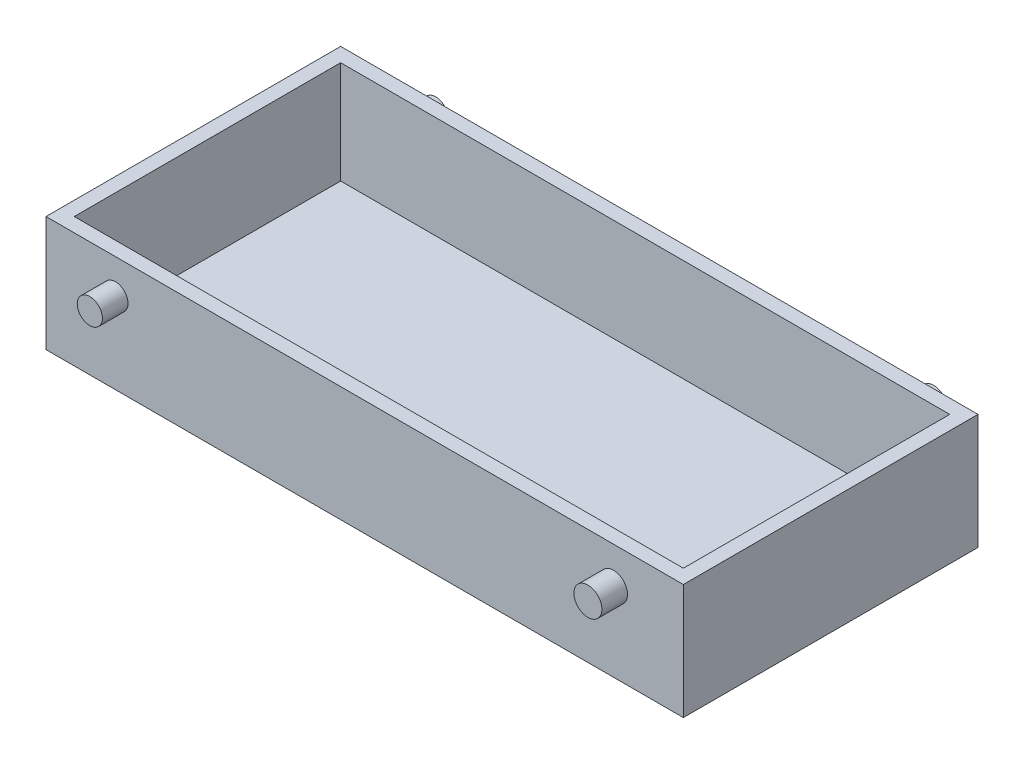
from build123d import *

# Parameters (mm, degrees)
SKETCH1_W           = 315.98108
SKETCH1_H           = 146.08048
SKETCH1_W_2         = 301.9806
SKETCH1_H_2         = 132.08
BOSS_EXTRUDE1_DEPTH = 50.8
SKETCH3_W           = 315.98108
SKETCH3_H           = 146.08048
BOSS_EXTRUDE2_DEPTH = 6.35
SKETCH4_R           = 6.24245598
SKETCH4_R_2         = 6.948260199
BOSS_EXTRUDE3_DEPTH = 12.7


with BuildPart() as part:
    # Sketch1 → Boss-Extrude1 (new body)
    with BuildSketch(Plane(origin=(0, 0, 0), x_dir=(1, 0, 0), z_dir=(0, 1, 0))):
        Rectangle(SKETCH1_W, SKETCH1_H)
        Rectangle(SKETCH1_W_2, SKETCH1_H_2, mode=Mode.SUBTRACT)
    extrude(amount=BOSS_EXTRUDE1_DEPTH)

    # Sketch3 → Boss-Extrude2 (add)
    with BuildSketch(Plane.XZ):
        Rectangle(SKETCH3_W, SKETCH3_H)
    extrude(amount=BOSS_EXTRUDE2_DEPTH)

    # Sketch4 → Boss-Extrude3 (add)
    with BuildSketch(Plane.XY.offset(73.04024)):
        with Locations((-123.56635706, 33.774135196)):
            Circle(SKETCH4_R)
        with Locations((123.378566243, 32.647390299)):
            Circle(SKETCH4_R_2)
    boss_extrude3 = extrude(amount=BOSS_EXTRUDE3_DEPTH)

    # Mirror1: Boss-Extrude3 across plane
    add(boss_extrude3.mirror(Plane.XY))


solid = part.part
